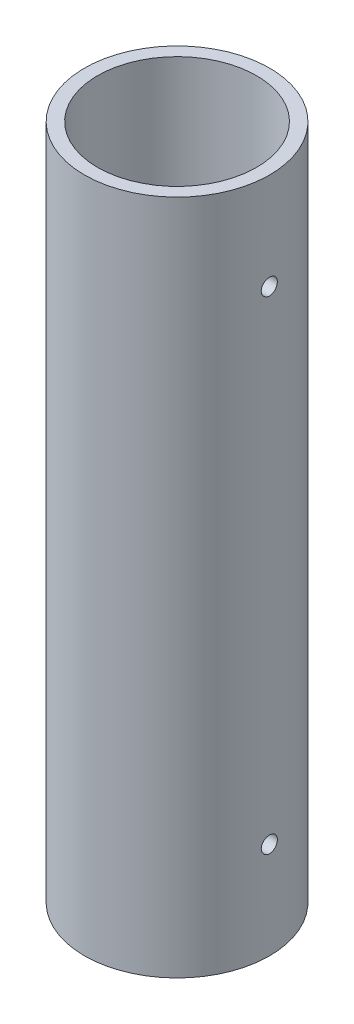
from build123d import *

# Parameters (mm, degrees)
SKETCH1_R                           = 36.5125
SKETCH1_R_2                         = 31.3563
BOSS_EXTRUDE1_DEPTH                 = 266.7
F_1_4_START                         = 31.195142544
F_1_4_0_25_DIAMETER_HOLE1_OUTLINE_R = 3.175
F_1_4_0_25_DIAMETER_HOLE1_DEPTH     = 5.317357524


# Read off the part's stored shape, not the designer's step: 1/4 (0.25) Diameter Hole1
with BuildPart() as part:
    # Sketch1 → Boss-Extrude1 (new body)
    with BuildSketch(Plane(origin=(0, 0, 0), x_dir=(1, 0, 0), z_dir=(0, 1, 0))):
        with Locations(Location((0, 0, 0), (0, 0, 270))):
            Circle(SKETCH1_R)
        with Locations(Location((0, 0, 0), (0, 0, 270))):
            Circle(SKETCH1_R_2, mode=Mode.SUBTRACT)
    extrude(amount=-BOSS_EXTRUDE1_DEPTH)

    # 1/4 (0.25) Diameter Hole1 outline → 1/4 (0.25) Diameter Hole1 (cut)
    with BuildSketch(Plane.YZ.offset(F_1_4_START)):
        with Locations((-228.6, 0)):
            Circle(F_1_4_0_25_DIAMETER_HOLE1_OUTLINE_R)
        with Locations((-38.1, 0)):
            Circle(F_1_4_0_25_DIAMETER_HOLE1_OUTLINE_R)
    extrude(amount=F_1_4_0_25_DIAMETER_HOLE1_DEPTH, mode=Mode.SUBTRACT)


solid = part.part
